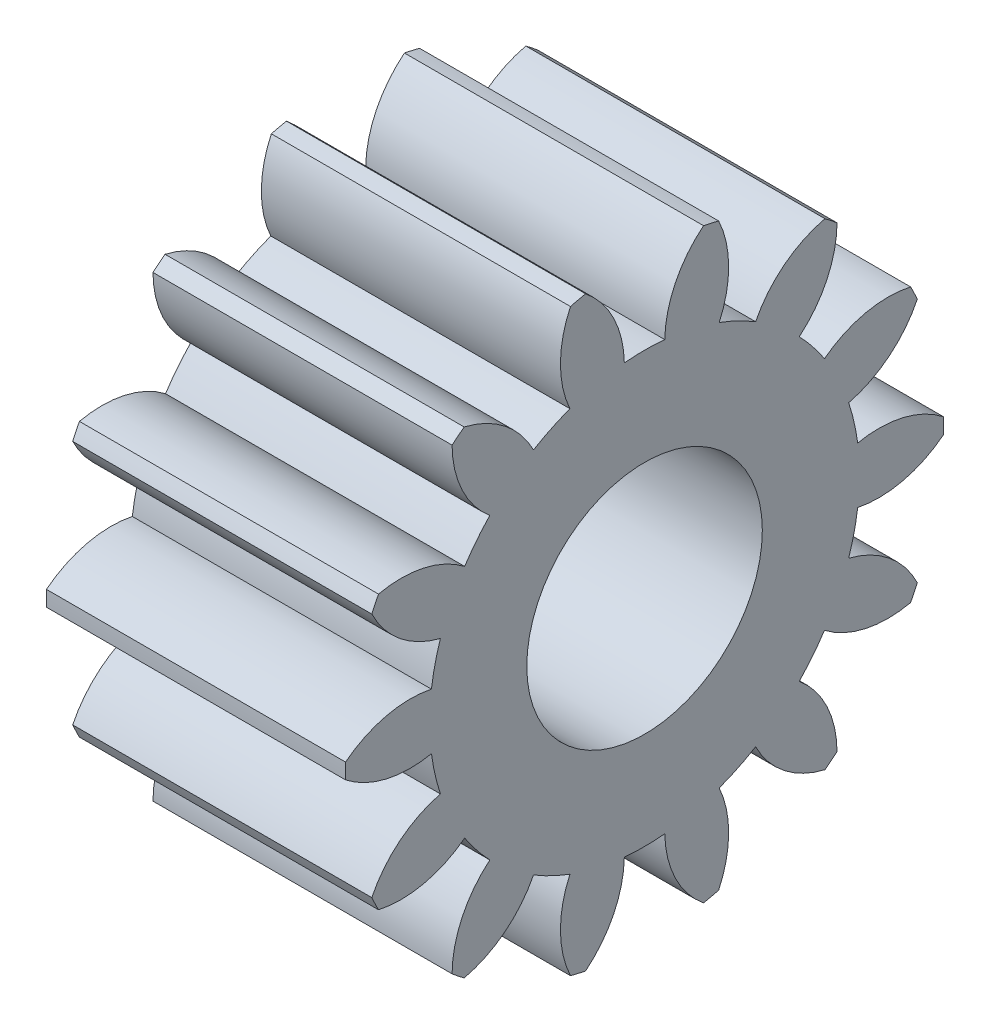
from build123d import *

# Parameters (mm, degrees)
BOSS_EXTRUDE1_START       = -4.9
BOSS_EXTRUDE1_DEPTH       = 4.9
BOSS_EXTRUDE1_START_2     = -8
BOSS_EXTRUDE1_2_OUTLINE_R = 5
BOSS_EXTRUDE1_2_DEPTH     = 3.1
SKETCH2_R                 = 5.05
CUT_EXTRUDE1_DEPTH        = 3.1
SKETCH3_R                 = 3.25
CUT_EXTRUDE2_DEPTH        = 13.227872143
SKETCH4_R                 = 4
CUT_EXTRUDE3_DEPTH        = 10
SKETCH5_R                 = 4
SKETCH5_R_2               = 3
BOSS_EXTRUDE2_DEPTH       = 4.9
BOSS_EXTRUDE3_DEPTH       = 1
BOSS_EXTRUDE3_DEPTH_BACK  = 1
FILLET1_R                 = 1
SKETCH8_R                 = 3.15
CUT_EXTRUDE4_DEPTH        = 10


with BuildPart() as part:
    # Boss-Extrude1: read off the stored shape, not the designer's step
    # Boss-Extrude1 outline → Boss-Extrude1 (new body)
    with BuildSketch(Plane(origin=(8, 0, 0), x_dir=(0, 0, -1), z_dir=(1, 0, 0)).offset(BOSS_EXTRUDE1_START)):
        with BuildLine():
            ThreePointArc((-7.295176575, -3.283351754), (-7.207750943, -3.471069913), (-7.115495966, -3.656462382))
            ThreePointArc((-7.115495966, -3.656462382), (-5.907248739, -3.655787226), (-4.811777955, -3.146075955))
            ThreePointArc((-4.811777955, -3.146075955), (-4.494749193, -3.584442871), (-4.137918587, -3.991068875))
            ThreePointArc((-4.137918587, -3.991068875), (-4.878615514, -4.945652492), (-5.148134044, -6.123456202))
            ThreePointArc((-5.148134044, -6.123456202), (-4.987918415, -6.25465186), (-4.824360775, -6.381656769))
            ThreePointArc((-4.824360775, -6.381656769), (-3.736060578, -5.856809649), (-2.970230937, -4.922268702))
            ThreePointArc((-2.970230937, -4.922268702), (-2.494397616, -5.179670022), (-1.996475938, -5.391204395))
            ThreePointArc((-1.996475938, -5.391204395), (-2.249642501, -6.572630868), (-1.981440428, -7.750735051))
            ThreePointArc((-1.981440428, -7.750735051), (-1.780167471, -7.799423297), (-1.577701765, -7.842885766))
            ThreePointArc((-1.577701765, -7.842885766), (-0.824899799, -6.897819092), (-0.540393256, -5.723545765))
            ThreePointArc((-0.540393256, -5.723545765), (0, -5.749), (0.540393256, -5.723545765))
            ThreePointArc((0.540393256, -5.723545765), (0.824899799, -6.897819092), (1.577701765, -7.842885766))
            ThreePointArc((1.577701765, -7.842885766), (1.780167471, -7.799423297), (1.981440428, -7.750735051))
            ThreePointArc((1.981440428, -7.750735051), (2.249642501, -6.572630868), (1.996475938, -5.391204395))
            ThreePointArc((1.996475938, -5.391204395), (2.494397616, -5.179670022), (2.970230937, -4.922268702))
            ThreePointArc((2.970230937, -4.922268702), (3.736060578, -5.856809649), (4.824360775, -6.381656769))
            ThreePointArc((4.824360775, -6.381656769), (4.987918415, -6.25465186), (5.148134044, -6.123456202))
            ThreePointArc((5.148134044, -6.123456202), (4.878615514, -4.945652492), (4.137918587, -3.991068875))
            ThreePointArc((4.137918587, -3.991068875), (4.494749193, -3.584442871), (4.811777955, -3.146075955))
            ThreePointArc((4.811777955, -3.146075955), (5.907248739, -3.655787226), (7.115495966, -3.656462382))
            ThreePointArc((7.115495966, -3.656462382), (7.207750943, -3.471069913), (7.295176575, -3.283351754))
            ThreePointArc((7.295176575, -3.283351754), (6.541318892, -2.339126986), (5.459795711, -1.800453218))
            ThreePointArc((5.459795711, -1.800453218), (5.604860567, -1.27927285), (5.700293335, -0.746764281))
            ThreePointArc((5.700293335, -0.746764281), (6.90843384, -0.730691307), (7.997319916, -0.207060777))
            ThreePointArc((7.997319916, -0.207060777), (8, 0), (7.997319916, 0.207060777))
            ThreePointArc((7.997319916, 0.207060777), (6.90843384, 0.730691307), (5.700293335, 0.746764281))
            ThreePointArc((5.700293335, 0.746764281), (5.604860567, 1.27927285), (5.459795711, 1.800453218))
            ThreePointArc((5.459795711, 1.800453218), (6.541318892, 2.339126986), (7.295176575, 3.283351754))
            ThreePointArc((7.295176575, 3.283351754), (7.207750943, 3.471069913), (7.115495966, 3.656462382))
            ThreePointArc((7.115495966, 3.656462382), (5.907248739, 3.655787226), (4.811777955, 3.146075955))
            ThreePointArc((4.811777955, 3.146075955), (4.494749193, 3.584442871), (4.137918587, 3.991068875))
            ThreePointArc((4.137918587, 3.991068875), (4.878615514, 4.945652492), (5.148134044, 6.123456202))
            ThreePointArc((5.148134044, 6.123456202), (4.987918415, 6.25465186), (4.824360775, 6.381656769))
            ThreePointArc((4.824360775, 6.381656769), (3.736060578, 5.856809649), (2.970230937, 4.922268702))
            ThreePointArc((2.970230937, 4.922268702), (2.494397616, 5.179670022), (1.996475938, 5.391204395))
            ThreePointArc((1.996475938, 5.391204395), (2.249642501, 6.572630868), (1.981440428, 7.750735051))
            ThreePointArc((1.981440428, 7.750735051), (1.780167471, 7.799423297), (1.577701765, 7.842885766))
            ThreePointArc((1.577701765, 7.842885766), (0.824899799, 6.897819092), (0.540393256, 5.723545765))
            ThreePointArc((0.540393256, 5.723545765), (0, 5.749), (-0.540393256, 5.723545765))
            ThreePointArc((-0.540393256, 5.723545765), (-0.824899799, 6.897819092), (-1.577701765, 7.842885766))
            ThreePointArc((-1.577701765, 7.842885766), (-1.780167471, 7.799423297), (-1.981440428, 7.750735051))
            ThreePointArc((-1.981440428, 7.750735051), (-2.249642501, 6.572630868), (-1.996475938, 5.391204395))
            ThreePointArc((-1.996475938, 5.391204395), (-2.494397616, 5.179670022), (-2.970230937, 4.922268702))
            ThreePointArc((-2.970230937, 4.922268702), (-3.736060578, 5.856809649), (-4.824360775, 6.381656769))
            ThreePointArc((-4.824360775, 6.381656769), (-4.987918415, 6.25465186), (-5.148134044, 6.123456202))
            ThreePointArc((-5.148134044, 6.123456202), (-4.878615514, 4.945652492), (-4.137918587, 3.991068875))
            ThreePointArc((-4.137918587, 3.991068875), (-4.494749193, 3.584442871), (-4.811777955, 3.146075955))
            ThreePointArc((-4.811777955, 3.146075955), (-5.907248739, 3.655787226), (-7.115495966, 3.656462382))
            ThreePointArc((-7.115495966, 3.656462382), (-7.207750943, 3.471069913), (-7.295176575, 3.283351754))
            ThreePointArc((-7.295176575, 3.283351754), (-6.541318892, 2.339126986), (-5.459795711, 1.800453218))
            ThreePointArc((-5.459795711, 1.800453218), (-5.604860567, 1.27927285), (-5.700293335, 0.746764281))
            ThreePointArc((-5.700293335, 0.746764281), (-6.90843384, 0.730691307), (-7.997319916, 0.207060777))
            ThreePointArc((-7.997319916, 0.207060777), (-8, 0), (-7.997319916, -0.207060777))
            ThreePointArc((-7.997319916, -0.207060777), (-6.90843384, -0.730691307), (-5.700293335, -0.746764281))
            ThreePointArc((-5.700293335, -0.746764281), (-5.604860567, -1.27927285), (-5.459795711, -1.800453218))
            ThreePointArc((-5.459795711, -1.800453218), (-6.541318892, -2.339126986), (-7.295176575, -3.283351754))
        make_face()
    extrude(amount=BOSS_EXTRUDE1_DEPTH)

    # Boss-Extrude1 2 outline → Boss-Extrude1 2 (add)
    with BuildSketch(Plane(origin=(8, 0, 0), x_dir=(0, 0, -1), z_dir=(1, 0, 0)).offset(BOSS_EXTRUDE1_START_2)):
        with BuildLine():
            ThreePointArc((-7.295176575, -3.283351754), (-7.207750943, -3.471069913), (-7.115495966, -3.656462382))
            ThreePointArc((-7.115495966, -3.656462382), (-5.907248739, -3.655787226), (-4.811777955, -3.146075955))
            ThreePointArc((-4.811777955, -3.146075955), (-4.494749193, -3.584442871), (-4.137918587, -3.991068875))
            ThreePointArc((-4.137918587, -3.991068875), (-4.878615514, -4.945652492), (-5.148134044, -6.123456202))
            ThreePointArc((-5.148134044, -6.123456202), (-4.987918415, -6.25465186), (-4.824360775, -6.381656769))
            ThreePointArc((-4.824360775, -6.381656769), (-3.736060578, -5.856809649), (-2.970230937, -4.922268702))
            ThreePointArc((-2.970230937, -4.922268702), (-2.494397616, -5.179670022), (-1.996475938, -5.391204395))
            ThreePointArc((-1.996475938, -5.391204395), (-2.249642501, -6.572630868), (-1.981440428, -7.750735051))
            ThreePointArc((-1.981440428, -7.750735051), (-1.780167471, -7.799423297), (-1.577701765, -7.842885766))
            ThreePointArc((-1.577701765, -7.842885766), (-0.824899799, -6.897819092), (-0.540393256, -5.723545765))
            ThreePointArc((-0.540393256, -5.723545765), (0, -5.749), (0.540393256, -5.723545765))
            ThreePointArc((0.540393256, -5.723545765), (0.824899799, -6.897819092), (1.577701765, -7.842885766))
            ThreePointArc((1.577701765, -7.842885766), (1.780167471, -7.799423297), (1.981440428, -7.750735051))
            ThreePointArc((1.981440428, -7.750735051), (2.249642501, -6.572630868), (1.996475938, -5.391204395))
            ThreePointArc((1.996475938, -5.391204395), (2.494397616, -5.179670022), (2.970230937, -4.922268702))
            ThreePointArc((2.970230937, -4.922268702), (3.736060578, -5.856809649), (4.824360775, -6.381656769))
            ThreePointArc((4.824360775, -6.381656769), (4.987918415, -6.25465186), (5.148134044, -6.123456202))
            ThreePointArc((5.148134044, -6.123456202), (4.878615514, -4.945652492), (4.137918587, -3.991068875))
            ThreePointArc((4.137918587, -3.991068875), (4.494749193, -3.584442871), (4.811777955, -3.146075955))
            ThreePointArc((4.811777955, -3.146075955), (5.907248739, -3.655787226), (7.115495966, -3.656462382))
            ThreePointArc((7.115495966, -3.656462382), (7.207750943, -3.471069913), (7.295176575, -3.283351754))
            ThreePointArc((7.295176575, -3.283351754), (6.541318892, -2.339126986), (5.459795711, -1.800453218))
            ThreePointArc((5.459795711, -1.800453218), (5.604860567, -1.27927285), (5.700293335, -0.746764281))
            ThreePointArc((5.700293335, -0.746764281), (6.90843384, -0.730691307), (7.997319916, -0.207060777))
            ThreePointArc((7.997319916, -0.207060777), (8, 0), (7.997319916, 0.207060777))
            ThreePointArc((7.997319916, 0.207060777), (6.90843384, 0.730691307), (5.700293335, 0.746764281))
            ThreePointArc((5.700293335, 0.746764281), (5.604860567, 1.27927285), (5.459795711, 1.800453218))
            ThreePointArc((5.459795711, 1.800453218), (6.541318892, 2.339126986), (7.295176575, 3.283351754))
            ThreePointArc((7.295176575, 3.283351754), (7.207750943, 3.471069913), (7.115495966, 3.656462382))
            ThreePointArc((7.115495966, 3.656462382), (5.907248739, 3.655787226), (4.811777955, 3.146075955))
            ThreePointArc((4.811777955, 3.146075955), (4.494749193, 3.584442871), (4.137918587, 3.991068875))
            ThreePointArc((4.137918587, 3.991068875), (4.878615514, 4.945652492), (5.148134044, 6.123456202))
            ThreePointArc((5.148134044, 6.123456202), (4.987918415, 6.25465186), (4.824360775, 6.381656769))
            ThreePointArc((4.824360775, 6.381656769), (3.736060578, 5.856809649), (2.970230937, 4.922268702))
            ThreePointArc((2.970230937, 4.922268702), (2.494397616, 5.179670022), (1.996475938, 5.391204395))
            ThreePointArc((1.996475938, 5.391204395), (2.249642501, 6.572630868), (1.981440428, 7.750735051))
            ThreePointArc((1.981440428, 7.750735051), (1.780167471, 7.799423297), (1.577701765, 7.842885766))
            ThreePointArc((1.577701765, 7.842885766), (0.824899799, 6.897819092), (0.540393256, 5.723545765))
            ThreePointArc((0.540393256, 5.723545765), (0, 5.749), (-0.540393256, 5.723545765))
            ThreePointArc((-0.540393256, 5.723545765), (-0.824899799, 6.897819092), (-1.577701765, 7.842885766))
            ThreePointArc((-1.577701765, 7.842885766), (-1.780167471, 7.799423297), (-1.981440428, 7.750735051))
            ThreePointArc((-1.981440428, 7.750735051), (-2.249642501, 6.572630868), (-1.996475938, 5.391204395))
            ThreePointArc((-1.996475938, 5.391204395), (-2.494397616, 5.179670022), (-2.970230937, 4.922268702))
            ThreePointArc((-2.970230937, 4.922268702), (-3.736060578, 5.856809649), (-4.824360775, 6.381656769))
            ThreePointArc((-4.824360775, 6.381656769), (-4.987918415, 6.25465186), (-5.148134044, 6.123456202))
            ThreePointArc((-5.148134044, 6.123456202), (-4.878615514, 4.945652492), (-4.137918587, 3.991068875))
            ThreePointArc((-4.137918587, 3.991068875), (-4.494749193, 3.584442871), (-4.811777955, 3.146075955))
            ThreePointArc((-4.811777955, 3.146075955), (-5.907248739, 3.655787226), (-7.115495966, 3.656462382))
            ThreePointArc((-7.115495966, 3.656462382), (-7.207750943, 3.471069913), (-7.295176575, 3.283351754))
            ThreePointArc((-7.295176575, 3.283351754), (-6.541318892, 2.339126986), (-5.459795711, 1.800453218))
            ThreePointArc((-5.459795711, 1.800453218), (-5.604860567, 1.27927285), (-5.700293335, 0.746764281))
            ThreePointArc((-5.700293335, 0.746764281), (-6.90843384, 0.730691307), (-7.997319916, 0.207060777))
            ThreePointArc((-7.997319916, 0.207060777), (-8, 0), (-7.997319916, -0.207060777))
            ThreePointArc((-7.997319916, -0.207060777), (-6.90843384, -0.730691307), (-5.700293335, -0.746764281))
            ThreePointArc((-5.700293335, -0.746764281), (-5.604860567, -1.27927285), (-5.459795711, -1.800453218))
            ThreePointArc((-5.459795711, -1.800453218), (-6.541318892, -2.339126986), (-7.295176575, -3.283351754))
        make_face()
        Circle(BOSS_EXTRUDE1_2_OUTLINE_R, mode=Mode.SUBTRACT)
    extrude(amount=BOSS_EXTRUDE1_2_DEPTH)

    # Sketch2 → Cut-Extrude1 (cut)
    with BuildSketch(Plane.ZY):
        Circle(SKETCH2_R)
    extrude(amount=-CUT_EXTRUDE1_DEPTH, mode=Mode.SUBTRACT)

    # Sketch3 → Cut-Extrude2 (cut, through all)
    with BuildSketch(Plane.ZY.offset(-3.1)):
        Circle(SKETCH3_R)
    extrude(amount=-CUT_EXTRUDE2_DEPTH, mode=Mode.SUBTRACT)

    # Sketch4 → Cut-Extrude3 (cut)
    with BuildSketch(Plane(origin=(8, 0, 0), x_dir=(0, 0, -1), z_dir=(1, 0, 0))):
        Circle(SKETCH4_R)
    extrude(amount=-CUT_EXTRUDE3_DEPTH, mode=Mode.SUBTRACT)

    # Sketch5 → Boss-Extrude2 (add)
    with BuildSketch(Plane(origin=(8, 0, 0), x_dir=(0, 0, -1), z_dir=(1, 0, 0))):
        Circle(SKETCH5_R)
        Circle(SKETCH5_R_2, mode=Mode.SUBTRACT)
    extrude(amount=-BOSS_EXTRUDE2_DEPTH)

    # Sketch7 → Boss-Extrude3 (add, two sides: drawn at the far end of the back side and taken through both)
    with BuildSketch(Plane.ZY.offset(-1.6).offset(-BOSS_EXTRUDE3_DEPTH_BACK)):
        with BuildLine():
            ThreePointArc((5.096691895, -0.934506311), (5.181657101, 0), (5.096691895, 0.934506311))
            ThreePointArc((5.096691895, 0.934506311), (4.95, 0), (5.096691895, -0.934506311))
        make_face()
        with BuildLine():
            ThreePointArc((-5.096691895, -0.934506311), (-4.95, 0), (-5.096691895, 0.934506311))
            ThreePointArc((-5.096691895, 0.934506311), (-5.181657101, 0), (-5.096691895, -0.934506311))
        make_face()
    extrude(amount=BOSS_EXTRUDE3_DEPTH + BOSS_EXTRUDE3_DEPTH_BACK)

    # Fillet1
    # the kernel refuses this fillet: 1 mm, written as the material it takes off along each edge
    with BuildSketch(Plane(origin=(0.6, 0, 8), x_dir=(0, 0.853406197512974, -0.5212464503921795), z_dir=(0, 0.5212464503921795, 0.853406197512974))) as fillet1_piece_1_section:
        with BuildLine():
            CenterArc((3.05 - FILLET1_R, -FILLET1_R), FILLET1_R, 0, 90)
            Line((3.05, -FILLET1_R), (3.05, 0))
            Line((3.05, 0), (3.05 - FILLET1_R, 0))
        make_face()
    fillet1_piece_1 = revolve(axis=Axis((0.6, 0, 8), (-1, 0, 0)), revolution_arc=117.16820376, mode=Mode.PRIVATE)
    fillet1_piece_1 = fillet1_piece_1 & Plane(origin=(0.6, 0, 0), x_dir=(0, 0, 1), z_dir=(-1, 0, 0)) * Cylinder(5.05, 13, mode=Mode.PRIVATE)
    add(fillet1_piece_1, mode=Mode.SUBTRACT)
    with BuildSketch(Plane(origin=(0.6, 0, -8), x_dir=(0, -0.8534061975130341, 0.521246450392081), z_dir=(0, -0.521246450392081, -0.8534061975130341))) as fillet1_piece_2_section:
        with BuildLine():
            CenterArc((3.05 - FILLET1_R, -FILLET1_R), FILLET1_R, 0, 90)
            Line((3.05 - FILLET1_R, 0), (3.05, 0))
            Line((3.05, 0), (3.05, -FILLET1_R))
        make_face()
    fillet1_piece_2 = revolve(axis=Axis((0.6, 0, -8), (-1, 0, 0)), revolution_arc=117.16820376, mode=Mode.PRIVATE)
    fillet1_piece_2 = fillet1_piece_2 & Plane(origin=(0.6, 0, 0), x_dir=(0, 0, 1), z_dir=(-1, 0, 0)) * Cylinder(5.05, 13, mode=Mode.PRIVATE)
    add(fillet1_piece_2, mode=Mode.SUBTRACT)
    with BuildSketch(Plane(origin=(2.6, 0, -8), x_dir=(0, -0.8534061975130341, 0.521246450392081), z_dir=(0, -0.521246450392081, -0.8534061975130341))) as fillet1_piece_3_section:
        with BuildLine():
            CenterArc((3.05 - FILLET1_R, FILLET1_R), FILLET1_R, 270, 90)
            Line((3.05 - FILLET1_R, 0), (3.05, 0))
            Line((3.05, 0), (3.05, FILLET1_R))
        make_face()
    fillet1_piece_3 = revolve(axis=Axis((2.6, 0, -8), (-1, 0, 0)), revolution_arc=117.16820376, mode=Mode.PRIVATE)
    fillet1_piece_3 = fillet1_piece_3 & Plane(origin=(2.6, 0, 0), x_dir=(0, 0, 1), z_dir=(-1, 0, 0)) * Cylinder(5.05, 13, mode=Mode.PRIVATE)
    add(fillet1_piece_3, mode=Mode.SUBTRACT)
    with BuildSketch(Plane(origin=(2.6, 0, 8), x_dir=(0, 0.853406197512974, -0.5212464503921795), z_dir=(0, 0.5212464503921795, 0.853406197512974))) as fillet1_piece_4_section:
        with BuildLine():
            CenterArc((3.05 - FILLET1_R, FILLET1_R), FILLET1_R, 270, 90)
            Line((3.05 - FILLET1_R, 0), (3.05, 0))
            Line((3.05, 0), (3.05, FILLET1_R))
        make_face()
    fillet1_piece_4 = revolve(axis=Axis((2.6, 0, 8), (-1, 0, 0)), revolution_arc=117.16820376, mode=Mode.PRIVATE)
    fillet1_piece_4 = fillet1_piece_4 & Plane(origin=(2.6, 0, 0), x_dir=(0, 0, 1), z_dir=(-1, 0, 0)) * Cylinder(5.05, 13, mode=Mode.PRIVATE)
    add(fillet1_piece_4, mode=Mode.SUBTRACT)

    # Sketch8 → Cut-Extrude4 (cut)
    with BuildSketch(Plane.ZY.offset(-3.1)):
        Circle(SKETCH8_R)
    extrude(amount=-CUT_EXTRUDE4_DEPTH, mode=Mode.SUBTRACT)


solid = part.part
